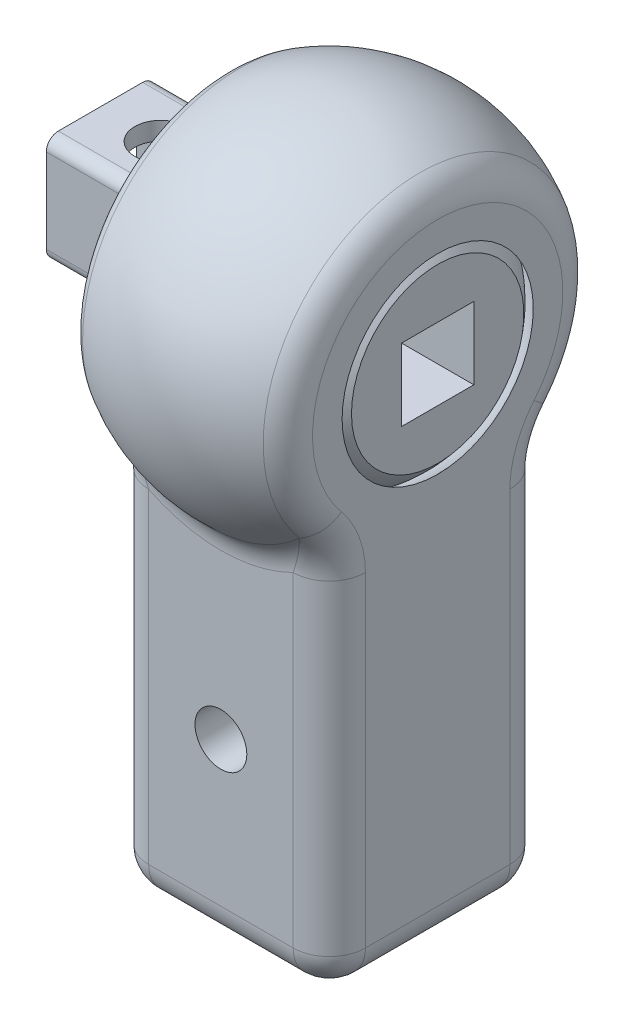
from build123d import *

# Parameters (mm, degrees)
CORTAR_EXTRUIR1_DEPTH        = 61.819404798
CORTAR_EXTRUIR1_DEPTH_BACK   = 61.819404798
SALIENTE_EXTRUIR1_REACH      = 61.624
SALIENTE_EXTRUIR1_END_RADIUS = 15
CROQUIS3_W                   = 18
CROQUIS3_H                   = 18
CORTAR_EXTRUIR2_DEPTH        = 62.627915753
CORTAR_EXTRUIR2_DEPTH_BACK   = 62.627915753
CROQUIS4_W                   = 6
CROQUIS4_H                   = 6
CROQUIS5_W                   = 9
CROQUIS5_H                   = 9
CROQUIS5_W_2                 = 6
CROQUIS5_H_2                 = 6
SALIENTE_EXTRUIR2_DEPTH      = 10
CORTAR_EXTRUIR3_DEPTH        = 65.699304478
CORTAR_EXTRUIR3_DEPTH_BACK   = 65.699304478
CROQUIS7_R                   = 2.15
REDONDEO1_R                  = 3
CROQUIS8_R                   = 2.15
CORTAR_EXTRUIR4_DEPTH        = 10
REDONDEO2_R                  = 1
REDONDEO3_R                  = 0.5


with BuildPart() as part:
    # Croquis1 → Revolución1 (revolve)
    with BuildSketch(Plane.XY):
        with BuildLine():
            Line((0, 27), (0, 30))
            ThreePointArc((0, 30), (12, 42), (0, 54))
            Line((0, 54), (0, 57))
            ThreePointArc((0, 57), (15, 42), (0, 27))
        make_face()
        with BuildLine():
            Line((0, 30.5), (0, 53.5))
            ThreePointArc((0, 53.5), (11.5, 42), (0, 30.5))
        make_face()
    revolve(axis=Axis((0, 0, 0), (0, 1, 0)))

    # Croquis2 → Cortar-Extruir1 (cut, two sides: drawn at the far end of the back side and taken through both)
    with BuildSketch(Plane.XY.offset(-CORTAR_EXTRUIR1_DEPTH_BACK)):
        Polygon((-9, 42), (-9, 57), (-19, 57), (-19, 27), (-9, 27), align=None)
        Polygon((19, 27), (9, 27), (9, 42), (9, 57), (19, 57), align=None)
    extrude(amount=CORTAR_EXTRUIR1_DEPTH + CORTAR_EXTRUIR1_DEPTH_BACK, mode=Mode.SUBTRACT)

    # Saliente-Extruir1: up to this sphere (the profile starts outside it)
    saliente_extruir1_end = Location((0, 42, 0)) * Sphere(SALIENTE_EXTRUIR1_END_RADIUS, mode=Mode.PRIVATE)
    # Croquis3 → Saliente-Extruir1 (add, up to the surface)
    with BuildSketch(Plane(origin=(0, 0, 0), x_dir=(1, 0, 0), z_dir=(0, 1, 0)), mode=Mode.PRIVATE) as saliente_extruir1_sk1:
        Rectangle(CROQUIS3_W, CROQUIS3_H)
    saliente_extruir1_tool1 = extrude(saliente_extruir1_sk1.sketch, amount=SALIENTE_EXTRUIR1_REACH, mode=Mode.PRIVATE) - saliente_extruir1_end
    add(saliente_extruir1_tool1.solids().sort_by_distance((0, 0, 0))[0])

    # Croquis4 → Cortar-Extruir2 (cut, two sides: drawn at the far end of the back side and taken through both)
    with BuildSketch(Plane.ZY.offset(9).offset(-CORTAR_EXTRUIR2_DEPTH_BACK)):
        with Locations((0, 42)):
            Rectangle(CROQUIS4_W, CROQUIS4_H)
    extrude(amount=CORTAR_EXTRUIR2_DEPTH + CORTAR_EXTRUIR2_DEPTH_BACK, mode=Mode.SUBTRACT)

    # Croquis5 → Saliente-Extruir2 (add)
    with BuildSketch(Plane.ZY.offset(9)):
        with Locations((0, 42)):
            Rectangle(CROQUIS5_W, CROQUIS5_H)
        with Locations((0, 42)):
            Rectangle(CROQUIS5_W_2, CROQUIS5_H_2, mode=Mode.SUBTRACT)
    extrude(amount=SALIENTE_EXTRUIR2_DEPTH)

    # Croquis7 → Cortar-Extruir3 (cut, two sides: drawn at the far end of the back side and taken through both)
    with BuildSketch(Plane.XY.offset(9).offset(-CORTAR_EXTRUIR3_DEPTH_BACK)):
        with Locations((0, 15)):
            Circle(CROQUIS7_R)
    extrude(amount=CORTAR_EXTRUIR3_DEPTH + CORTAR_EXTRUIR3_DEPTH_BACK, mode=Mode.SUBTRACT)

    # Redondeo1
    redondeo1_edges = [part.edges().sort_by_distance(p)[0] for p in [
        (-9, 17.031373033, 9),
        (0, 0, 9),
        (-9, 0, 0),
        (0, 30, 9),
        (9, 17.031373033, 9),
        (-9, 54, 0),
        (-9, 17.031373033, -9),
        (9, 0, 0),
        (0, 0, -9),
        (9, 46.937253933, 10.937253933),
        (0, 30, -9),
        (9, 17.031373033, -9),
    ]]
    fillet(redondeo1_edges, radius=REDONDEO1_R)

    # Croquis8 → Cortar-Extruir4 (cut)
    with BuildSketch(Plane(origin=(0, 46.5, 0), x_dir=(1, 0, 0), z_dir=(0, 1, 0))):
        with Locations((-14, 0)):
            Circle(CROQUIS8_R)
    extrude(amount=-CORTAR_EXTRUIR4_DEPTH, mode=Mode.SUBTRACT)

    # Redondeo2
    redondeo2_edges = [part.edges().sort_by_distance(p)[0] for p in [
        (-14, 37.5, 4.5),
        (-14, 37.5, -4.5),
        (-14, 46.5, -4.5),
        (-14, 46.5, 4.5),
    ]]
    fillet(redondeo2_edges, radius=REDONDEO2_R)

    # Redondeo3
    redondeo3_edges = [part.edges().sort_by_distance(p)[0] for p in [
        (-9, 37.792893219, -4.207106781),
        (-9, 42, -4.5),
        (-9, 46.207106781, -4.207106781),
        (-9, 46.5, 0),
        (-9, 46.207106781, 4.207106781),
        (-9, 42, 4.5),
        (-9, 37.792893219, 4.207106781),
        (-9, 37.5, 0),
    ]]
    fillet(redondeo3_edges, radius=REDONDEO3_R)


solid = part.part
